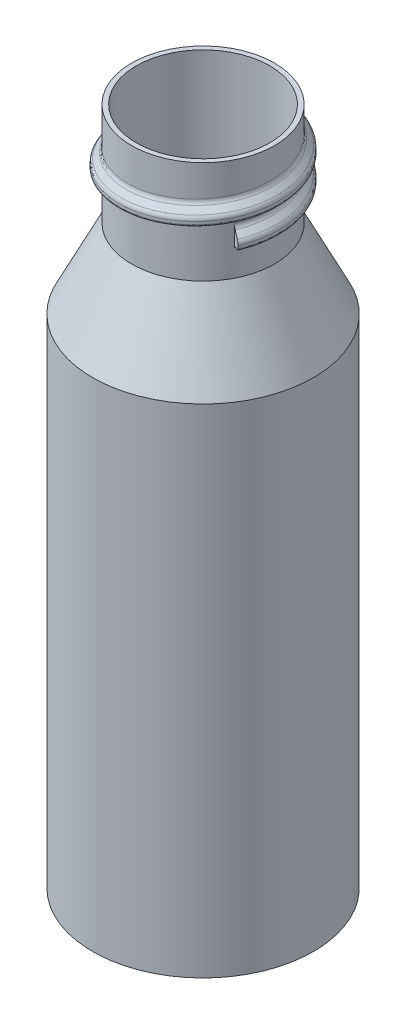
from build123d import *

# Parameters (mm, degrees)
THREAD_1_PITCH = 3.175


with BuildPart() as part:
    # Эскиз2 → Повернуть1 (revolve)
    with BuildSketch(Plane.XY, mode=Mode.PRIVATE) as revolve_1_sk:
        Polygon((0, 0), (14, 0), (14, 0.6), (0.6, 0.6), (0.6, 63), (5.536746465, 73), (5.536746465, 86), (4.936746465, 86), (4.936746465, 73), (0, 63), align=None)
    revolve(revolve_1_sk.sketch.rotate(Axis((14, 0, 0), (0, 1, 0)), 270), axis=Axis((14, 0, 0), (0, 1, 0)))

    # Резьба1: the profile of Профиль резьбы1 profile screwed along a right-hand helix of 1.574803 turns, 12 arcs to a turn; built about Z, then put on its axis
    thread_1_z = Axis((0, 0, 0), (0, 0, 1))
    thread_1_corners = [(9.062953535, 0, 0), (9.062953535, 0, 2.662362041), (9.063253535, 0, 2.662362041), (9.273146898, 0, 2.412220872), (9.920160172, 0, 2.298134974), (10.130053535, 0, 2.047993805), (10.130053535, 0, 1.698061469), (9.906868902, 0, 1.159246102), (9.286438168, 0, 0.538815367), (9.063253535, 0, 0)]
    with BuildLine(mode=Mode.PRIVATE) as thread_1_profile:
        Line(thread_1_corners[0], thread_1_corners[1])
        Line(thread_1_corners[3], thread_1_corners[4])
        Line(thread_1_corners[5], thread_1_corners[6])
        Line(thread_1_corners[7], thread_1_corners[8])
        Line(thread_1_corners[9], thread_1_corners[0])
        Line(thread_1_corners[2], thread_1_corners[1])
        ThreePointArc((9.063253535, 0, 2.662362041), (9.122678246, 0, 2.499093988), (9.273146898, 0, 2.412220872))
        ThreePointArc((9.920160172, 0, 2.298134974), (10.070628824, 0, 2.211261858), (10.130053535, 0, 2.047993805))
        ThreePointArc((10.130053535, 0, 1.698061469), (10.072049739, 0, 1.406456694), (9.906868902, 0, 1.159246102))
        ThreePointArc((9.286438168, 0, 0.538815367), (9.121257331, 0, 0.291604775), (9.063253535, 0, 0))
    thread_1_cap = Face(thread_1_profile.wire())
    thread_1_arcs = [((9.063253535, 0, 2.662362041), (9.063253535, 0, 2.449230735), (9.273146898, 0, 2.412220872), (1, 0.7660444431189758, 1)), ((9.920160172, 0, 2.298134974), (10.130053535, 0, 2.261125112), (10.130053535, 0, 2.047993805), (1, 0.7660444431189757, 1)), ((10.130053535, 0, 1.698061469), (10.130053535, 0, 1.382430735), (9.906868902, 0, 1.159246102), (1, 0.923879532511285, 1)), ((9.286438168, 0, 0.538815367), (9.063253535, 0, 0.315630735), (9.063253535, 0, 0), (1, 0.9238795325112861, 1))]  # start, shoulder, end, weights
    thread_1_turn_angles = [0, 15, 30, 45, 60, 75, 90, 105, 120, 135, 150, 165, 180, 195, 210, 225, 240, 255, 270, 285, 300, 315, 330, 345, 360]
    thread_1_turn_weights = [1, 0.9659258262890683, 1, 0.9659258262890683, 1, 0.9659258262890683, 1, 0.9659258262890683, 1, 0.9659258262890683, 1, 0.9659258262890683, 1, 0.9659258262890683, 1, 0.9659258262890683, 1, 0.9659258262890683, 1, 0.9659258262890683, 1, 0.9659258262890683, 1, 0.9659258262890683, 1]
    thread_1_turn_rails = [Edge.make_bspline([Vector(p[0], p[1], 0).rotate(thread_1_z, thread_1_turn_angles[k]) / thread_1_turn_weights[k] + Vector(0, 0, p[2] + THREAD_1_PITCH * thread_1_turn_angles[k] / 360) for k in range(25)], [0, 0, 0, 1, 1, 2, 2, 3, 3, 4, 4, 5, 5, 6, 6, 7, 7, 8, 8, 9, 9, 10, 10, 11, 11, 12, 12, 12], 2, thread_1_turn_weights) for p in thread_1_corners]
    thread_1_turn_sides = [*[Face.make_surface_from_curves(thread_1_turn_rails[p[0]], thread_1_turn_rails[p[1]]) for p in [(0, 1), (3, 4), (5, 6), (7, 8), (9, 0), (2, 1)]], *[Face.make_bezier_surface([[Vector(p[j][0], p[j][1], 0).rotate(thread_1_z, thread_1_turn_angles[2 * i + k]) / thread_1_turn_weights[2 * i + k] + Vector(0, 0, p[j][2] + THREAD_1_PITCH * thread_1_turn_angles[2 * i + k] / 360) for k in range(3)] for j in range(3)], [[p[3][j] * thread_1_turn_weights[2 * i + k] for k in range(3)] for j in range(3)]) for p in thread_1_arcs for i in range(12)]]
    thread_1_last_angles = [360, 375, 390, 405, 420, 435, 450, 465, 480, 495, 510, 525, 540, 553.464566929, 566.929133858]
    thread_1_last_weights = [1, 0.9659258262890683, 1, 0.9659258262890683, 1, 0.9659258262890683, 1, 0.9659258262890683, 1, 0.9659258262890683, 1, 0.9659258262890683, 1, 0.9725141026055468, 1]
    thread_1_last_rails = [Edge.make_bspline([Vector(p[0], p[1], 0).rotate(thread_1_z, thread_1_last_angles[k]) / thread_1_last_weights[k] + Vector(0, 0, p[2] + THREAD_1_PITCH * thread_1_last_angles[k] / 360) for k in range(15)], [0, 0, 0, 1, 1, 2, 2, 3, 3, 4, 4, 5, 5, 6, 6, 7, 7, 7], 2, thread_1_last_weights) for p in thread_1_corners]
    thread_1_last_sides = [*[Face.make_surface_from_curves(thread_1_last_rails[p[0]], thread_1_last_rails[p[1]]) for p in [(0, 1), (3, 4), (5, 6), (7, 8), (9, 0), (2, 1)]], *[Face.make_bezier_surface([[Vector(p[j][0], p[j][1], 0).rotate(thread_1_z, thread_1_last_angles[2 * i + k]) / thread_1_last_weights[2 * i + k] + Vector(0, 0, p[j][2] + THREAD_1_PITCH * thread_1_last_angles[2 * i + k] / 360) for k in range(3)] for j in range(3)], [[p[3][j] * thread_1_last_weights[2 * i + k] for k in range(3)] for j in range(3)]) for p in thread_1_arcs for i in range(7)]]
    thread_1 = Plane(origin=(14, 84, 0), x_dir=(-1, 0, 0), z_dir=(0, -1, 0)) * Solid(Shell([*thread_1_turn_sides, *thread_1_last_sides, thread_1_cap, thread_1_cap.rotate(thread_1_z, 566.929133858).moved(Location((0, 0, THREAD_1_PITCH * 566.929133858 / 360)))]))
    add(thread_1)


solid = part.part
